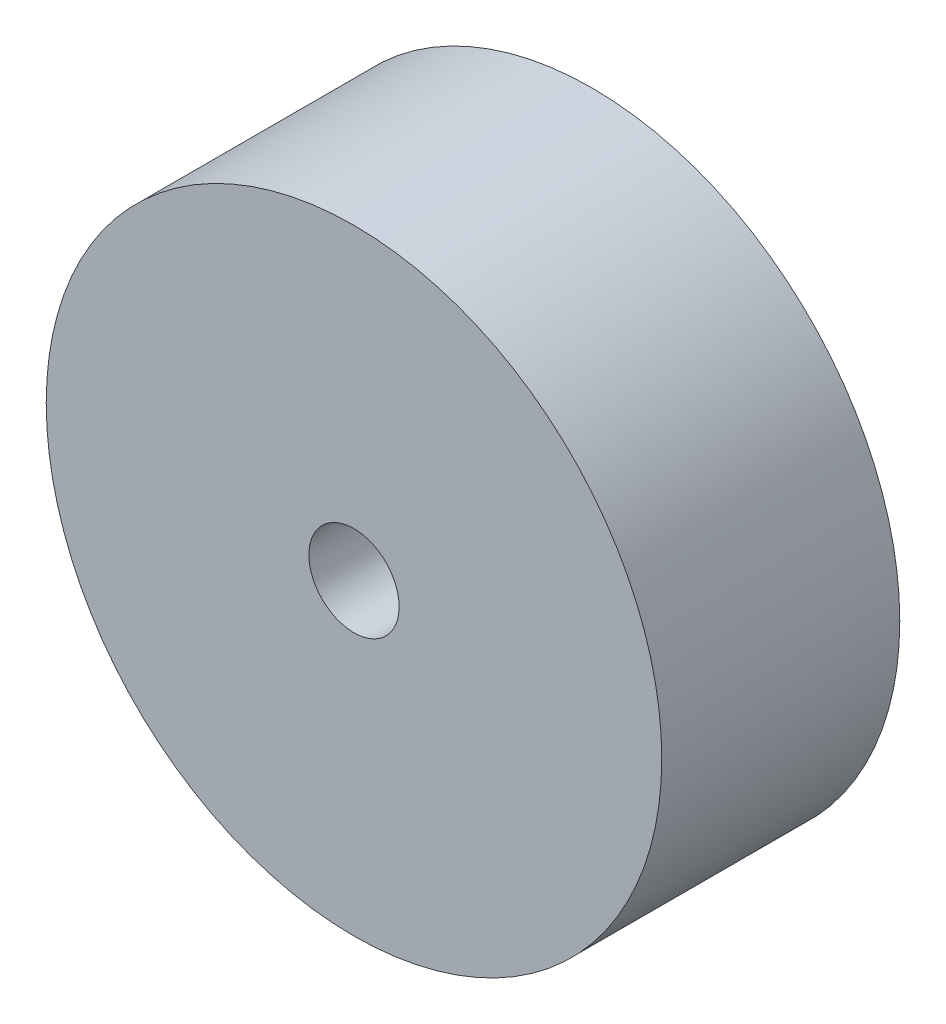
from build123d import *

# Parameters (mm, degrees)
SKETCH1_R           = 7.5
BOSS_EXTRUDE1_DEPTH = 5.8
SKETCH2_R           = 6.4
CUT_EXTRUDE1_DEPTH  = 1.5875
SKETCH3_R           = 1
BOSS_EXTRUDE2_DEPTH = 1.5875
SKETCH4_R           = 1.5
BOSS_EXTRUDE3_DEPTH = 3
SKETCH5_R           = 0.85
CUT_EXTRUDE2_DEPTH  = 39.165579588
SKETCH6_R           = 1.1
CUT_EXTRUDE3_DEPTH  = 3


with BuildPart() as part:
    # Sketch1 → Boss-Extrude1 (new body)
    with BuildSketch(Plane.XY):
        with Locations((-29.082250471, -1.703826149)):
            Circle(SKETCH1_R)
    extrude(amount=BOSS_EXTRUDE1_DEPTH)

    # Sketch2 → Cut-Extrude1 (cut)
    with BuildSketch(Plane(origin=(0, 0, 0), x_dir=(-1, 0, 0), z_dir=(0, 0, -1))):
        with Locations((29.082250471, -1.703826149)):
            Circle(SKETCH2_R)
    extrude(amount=-CUT_EXTRUDE1_DEPTH, mode=Mode.SUBTRACT)

    # Sketch3 → Boss-Extrude2 (add)
    with BuildSketch(Plane(origin=(0, 0, 1.5875), x_dir=(-1, 0, 0), z_dir=(0, 0, -1))):
        with Locations((29.082250471, -1.703826149)):
            Circle(SKETCH3_R)
    extrude(amount=BOSS_EXTRUDE2_DEPTH)

    # Sketch4 → Boss-Extrude3 (add)
    with BuildSketch(Plane(origin=(0, 0, 0), x_dir=(-1, 0, 0), z_dir=(0, 0, -1))):
        with Locations((29.082250471, -1.703826149)):
            Circle(SKETCH4_R)
    extrude(amount=-BOSS_EXTRUDE3_DEPTH)

    # Sketch5 → Cut-Extrude2 (cut, through all)
    with BuildSketch(Plane(origin=(0, 0, 0), x_dir=(-1, 0, 0), z_dir=(0, 0, -1))):
        with Locations((29.082250471, -1.703826149)):
            Circle(SKETCH5_R)
    extrude(amount=-CUT_EXTRUDE2_DEPTH, mode=Mode.SUBTRACT)

    # Sketch6 → Cut-Extrude3 (cut)
    with BuildSketch(Plane.XY.offset(5.8)):
        with Locations((-29.082250471, -1.703826149)):
            Circle(SKETCH6_R)
    extrude(amount=-CUT_EXTRUDE3_DEPTH, mode=Mode.SUBTRACT)


solid = part.part
